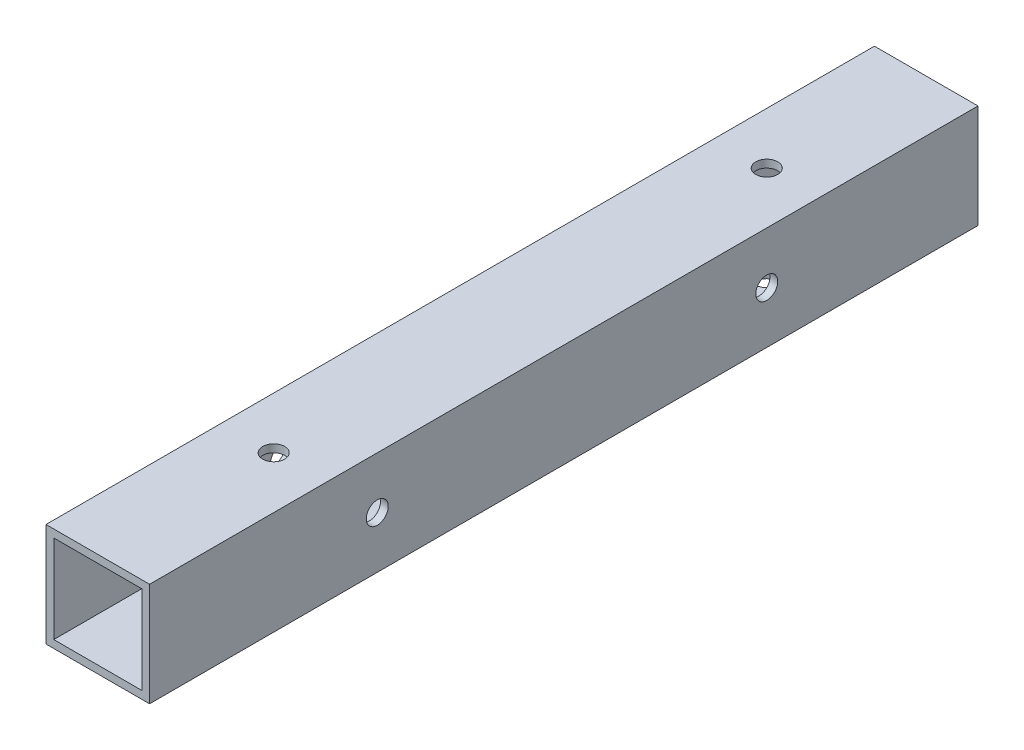
from build123d import *

# Parameters (mm, degrees)
SKETCH1_W           = 20
SKETCH1_H           = 20
SKETCH1_W_2         = 17
SKETCH1_H_2         = 17
BOSS_EXTRUDE1_DEPTH = 160
SKETCH2_R           = 2.125
CUT_EXTRUDE1_DEPTH  = 162.554944214
SKETCH3_R           = 2.125
CUT_EXTRUDE2_DEPTH  = 162.554944214


with BuildPart() as part:
    # Sketch1 → Boss-Extrude1 (new body)
    with BuildSketch(Plane.XY):
        Rectangle(SKETCH1_W, SKETCH1_H)
        Rectangle(SKETCH1_W_2, SKETCH1_H_2, mode=Mode.SUBTRACT)
    extrude(amount=-BOSS_EXTRUDE1_DEPTH)

    # Sketch2 → Cut-Extrude1 (cut, through all)
    with BuildSketch(Plane(origin=(0, 10, 0), x_dir=(1, 0, 0), z_dir=(0, 1, 0))):
        with Locations((0, 33.975)):
            Circle(SKETCH2_R)
        with Locations((0, 129.2)):
            Circle(SKETCH2_R)
    extrude(amount=-CUT_EXTRUDE1_DEPTH, mode=Mode.SUBTRACT)

    # Sketch3 → Cut-Extrude2 (cut, through all)
    with BuildSketch(Plane.ZY.offset(10)):
        with Locations((-43.975, 0)):
            Circle(SKETCH3_R)
        with Locations((-119.2, 0)):
            Circle(SKETCH3_R)
    extrude(amount=-CUT_EXTRUDE2_DEPTH, mode=Mode.SUBTRACT)


solid = part.part
